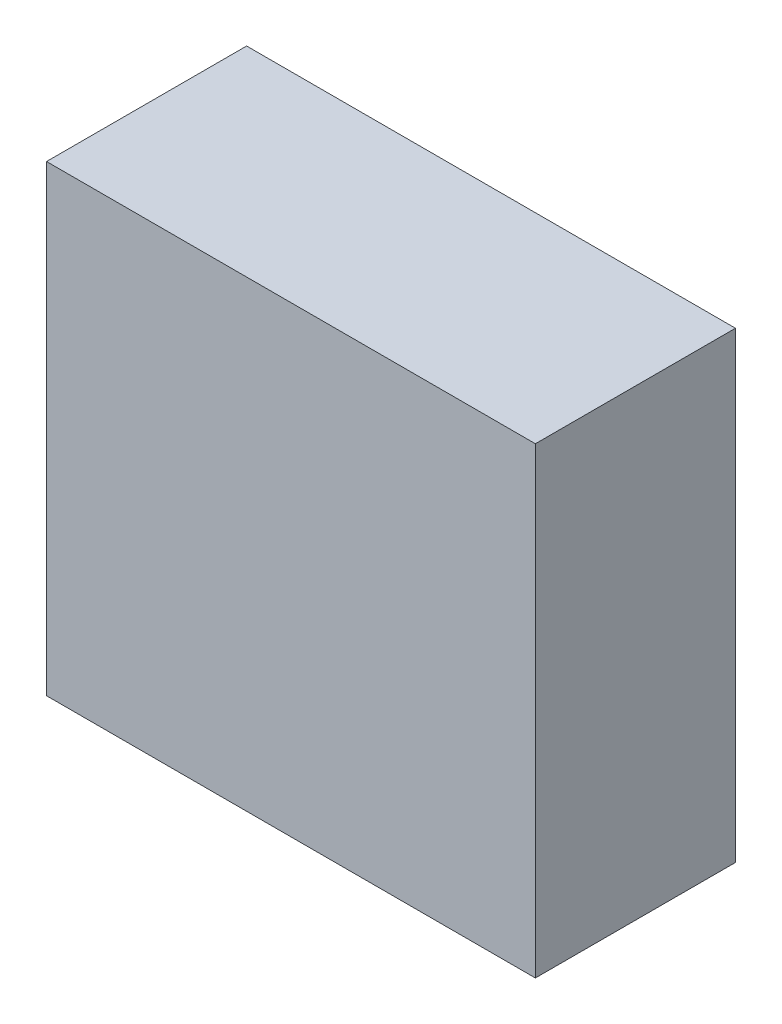
from build123d import *

# Parameters (mm, degrees)
SKETCH1_W      = 43
SKETCH1_H      = 40.7
ENVELOPE_DEPTH = 17.6


with BuildPart() as part:
    # Sketch1 → Envelope (new body)
    with BuildSketch(Plane.XY):
        Rectangle(SKETCH1_W, SKETCH1_H)
    extrude(amount=ENVELOPE_DEPTH)


solid = part.part
